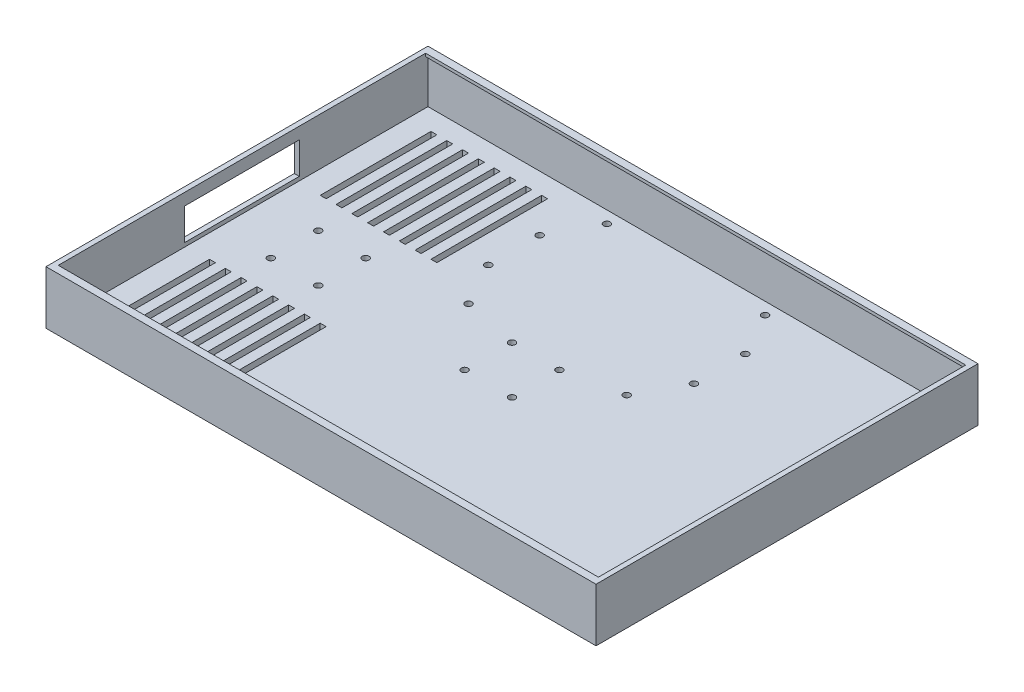
from build123d import *

# Parameters (mm, degrees)
SKETCH1_W                     = 278.2
SKETCH1_H                     = 193.2
SHELL_BLOCK_DEPTH             = 27
SKETCH2_W                     = 273.2
SKETCH2_H                     = 185.8
FRONT_OPENING_DEPTH           = 1.5
SKETCH3_W                     = 273.2
SKETCH3_H                     = 188.2
DISPLAY_POCKET_DEPTH          = 22.5
SKETCH4_W                     = 3
SKETCH4_H                     = 56
VENT_SLOTS_DEPTH              = 4
SKETCH5_W                     = 58
SKETCH5_H                     = 16
CABLE_EXIT_X_SHORT_SIDE_DEPTH = 140.1
SKETCH6_R                     = 1.7
BOLT_HOLES_DEPTH              = 4


with BuildPart() as part:
    # Sketch1 → Shell Block (new body)
    with BuildSketch(Plane(origin=(0, 0, 0), x_dir=(1, 0, 0), z_dir=(0, 1, 0))):
        Rectangle(SKETCH1_W, SKETCH1_H)
    extrude(amount=SHELL_BLOCK_DEPTH)

    # Sketch2 → Front Opening (cut)
    with BuildSketch(Plane(origin=(0, 27, 0), x_dir=(1, 0, 0), z_dir=(0, 1, 0))):
        Rectangle(SKETCH2_W, SKETCH2_H)
    extrude(amount=-FRONT_OPENING_DEPTH, mode=Mode.SUBTRACT)

    # Sketch3 → Display Pocket (cut)
    with BuildSketch(Plane(origin=(0, 25.5, 0), x_dir=(1, 0, 0), z_dir=(0, 1, 0))):
        Rectangle(SKETCH3_W, SKETCH3_H)
    extrude(amount=-DISPLAY_POCKET_DEPTH, mode=Mode.SUBTRACT)

    # Sketch4 → Vent Slots (cut)
    with BuildSketch(Plane(origin=(0, 3, 0), x_dir=(1, 0, 0), z_dir=(0, 1, 0))):
        with Locations((-67.5, 56)):
            Rectangle(SKETCH4_W, SKETCH4_H)
        with Locations((-67.5, -56)):
            Rectangle(SKETCH4_W, SKETCH4_H)
        with Locations((-75.5, 56)):
            Rectangle(SKETCH4_W, SKETCH4_H)
        with Locations((-75.5, -56)):
            Rectangle(SKETCH4_W, SKETCH4_H)
        with Locations((-83.5, 56)):
            Rectangle(SKETCH4_W, SKETCH4_H)
        with Locations((-83.5, -56)):
            Rectangle(SKETCH4_W, SKETCH4_H)
        with Locations((-91.5, 56)):
            Rectangle(SKETCH4_W, SKETCH4_H)
        with Locations((-91.5, -56)):
            Rectangle(SKETCH4_W, SKETCH4_H)
        with Locations((-99.5, 56)):
            Rectangle(SKETCH4_W, SKETCH4_H)
        with Locations((-99.5, -56)):
            Rectangle(SKETCH4_W, SKETCH4_H)
        with Locations((-107.5, 56)):
            Rectangle(SKETCH4_W, SKETCH4_H)
        with Locations((-107.5, -56)):
            Rectangle(SKETCH4_W, SKETCH4_H)
        with Locations((-115.5, 56)):
            Rectangle(SKETCH4_W, SKETCH4_H)
        with Locations((-115.5, -56)):
            Rectangle(SKETCH4_W, SKETCH4_H)
        with Locations((-123.5, 56)):
            Rectangle(SKETCH4_W, SKETCH4_H)
        with Locations((-123.5, -56)):
            Rectangle(SKETCH4_W, SKETCH4_H)
    extrude(amount=-VENT_SLOTS_DEPTH, mode=Mode.SUBTRACT)

    # Sketch5 → Cable Exit (-X short side) (cut)
    with BuildSketch(Plane(origin=(0, 0, 0), x_dir=(0, 0, -1), z_dir=(1, 0, 0))):
        with Locations((0, 13)):
            Rectangle(SKETCH5_W, SKETCH5_H)
    extrude(amount=-CABLE_EXIT_X_SHORT_SIDE_DEPTH, mode=Mode.SUBTRACT)

    # Sketch6 → Bolt Holes (cut)
    with BuildSketch(Plane(origin=(0, 3, 0), x_dir=(1, 0, 0), z_dir=(0, 1, 0))):
        with Locations((-40, 18)):
            Circle(SKETCH6_R)
        with Locations((-40, 88)):
            Circle(SKETCH6_R)
        with Locations((40, 18)):
            Circle(SKETCH6_R)
        with Locations((40, 88)):
            Circle(SKETCH6_R)
        with Locations((-52, 40)):
            Circle(SKETCH6_R)
        with Locations((-52, 66)):
            Circle(SKETCH6_R)
        with Locations((52, 40)):
            Circle(SKETCH6_R)
        with Locations((52, 66)):
            Circle(SKETCH6_R)
        with Locations((-12, -82)):
            Circle(SKETCH6_R)
        with Locations((12, -82)):
            Circle(SKETCH6_R)
        with Locations((124, -12)):
            Circle(SKETCH6_R)
        with Locations((124, 12)):
            Circle(SKETCH6_R)
        with Locations((-12, -12)):
            Circle(SKETCH6_R)
        with Locations((-12, 12)):
            Circle(SKETCH6_R)
        with Locations((12, -12)):
            Circle(SKETCH6_R)
        with Locations((12, 12)):
            Circle(SKETCH6_R)
        with Locations((-110, 12)):
            Circle(SKETCH6_R)
        with Locations((-110, -12)):
            Circle(SKETCH6_R)
        with Locations((-86, 12)):
            Circle(SKETCH6_R)
        with Locations((-86, -12)):
            Circle(SKETCH6_R)
    extrude(amount=-BOLT_HOLES_DEPTH, mode=Mode.SUBTRACT)


solid = part.part
